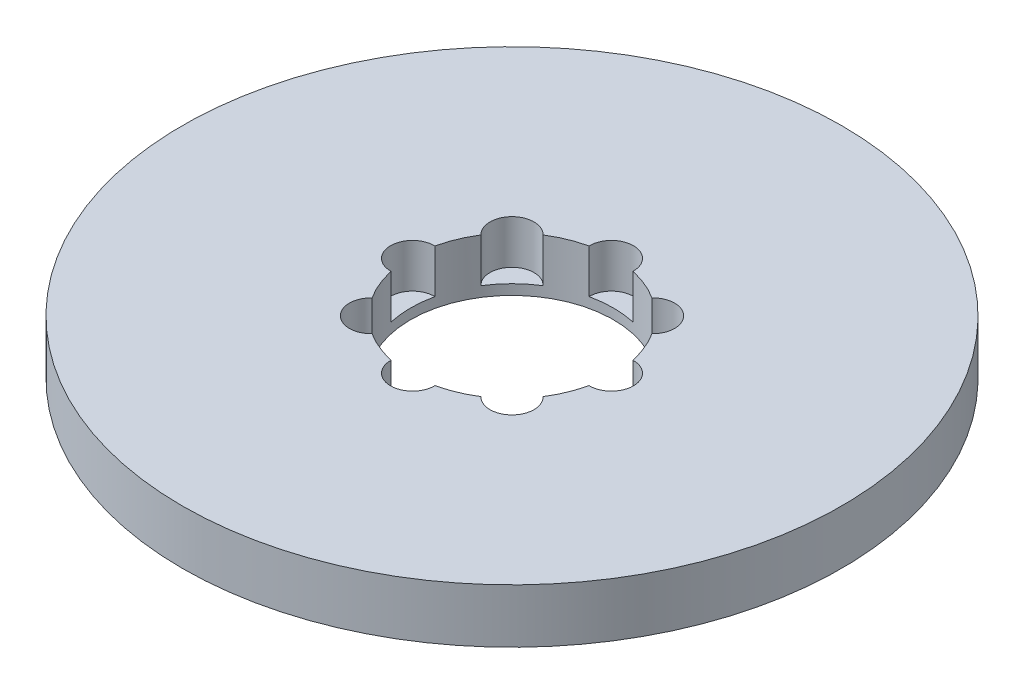
from build123d import *

# Parameters (mm, degrees)
SKETCH1_R           = 97.5
BOSS_EXTRUDE1_DEPTH = 16
SKETCH2_R           = 30
CUT_EXTRUDE1_DEPTH  = 139.811022617
SKETCH3_R           = 6.497636769
CUT_EXTRUDE2_DEPTH  = 12.985183022
CIRPATTERN1_COUNT   = 8


with BuildPart() as part:
    # Sketch1 → Boss-Extrude1 (new body)
    with BuildSketch(Plane(origin=(0, 0, 0), x_dir=(1, 0, 0), z_dir=(0, 1, 0))):
        Circle(SKETCH1_R)
    extrude(amount=BOSS_EXTRUDE1_DEPTH)

    # Sketch2 → Cut-Extrude1 (cut, through all)
    with BuildSketch(Plane(origin=(0, 0, 0), x_dir=(1, 0, 0), z_dir=(0, 1, 0))):
        Circle(SKETCH2_R)
    extrude(amount=CUT_EXTRUDE1_DEPTH, mode=Mode.SUBTRACT)

    # Sketch3 → Cut-Extrude2 (cut)
    with BuildSketch(Plane(origin=(0, 16, 0), x_dir=(1, 0, 0), z_dir=(0, 1, 0))):
        with Locations((-29.428839134, 0)):
            Circle(SKETCH3_R)
    cut_extrude2 = extrude(amount=-CUT_EXTRUDE2_DEPTH, mode=Mode.SUBTRACT)

    # CirPattern1: Cut-Extrude2 ×8 about axis
    cirpattern1_axis = Axis((0, 0, 0), (0, 1, 0))
    for i in range(1, CIRPATTERN1_COUNT):
        add(cut_extrude2.rotate(cirpattern1_axis, i * 360 / CIRPATTERN1_COUNT), mode=Mode.SUBTRACT)


solid = part.part
